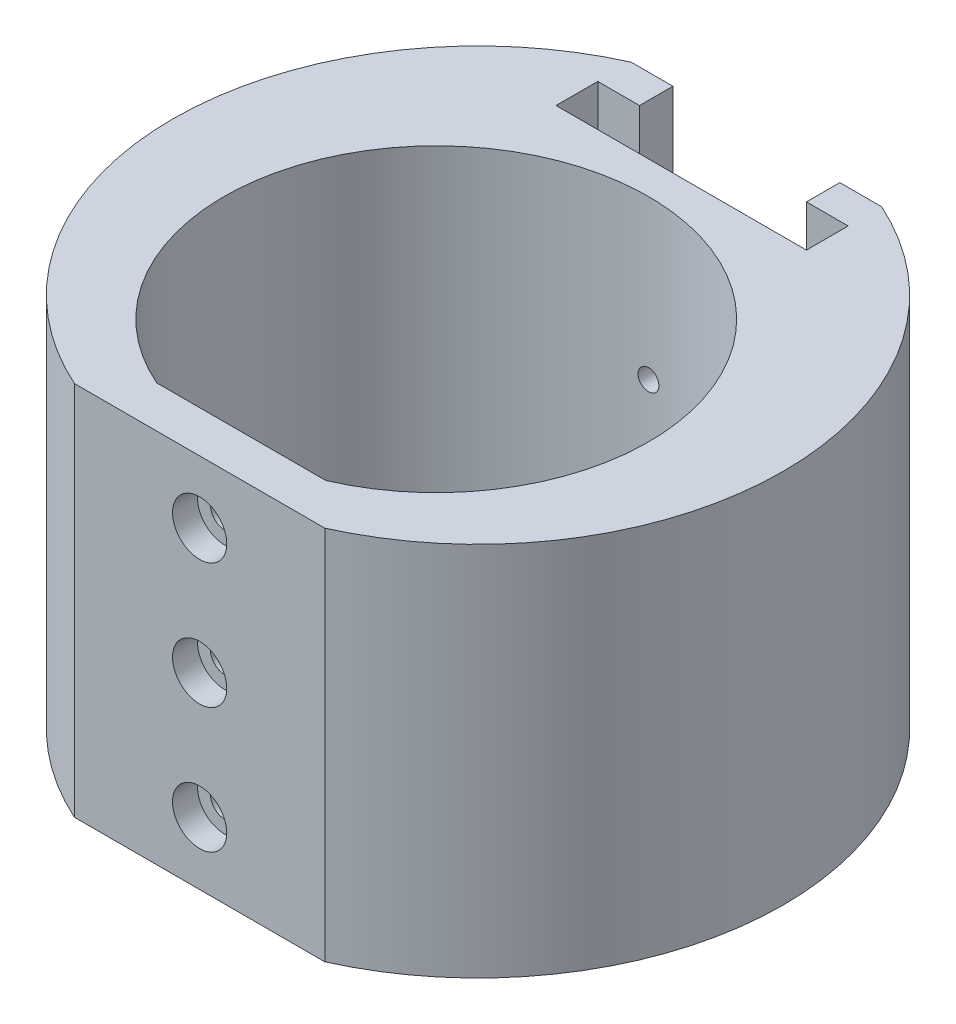
from build123d import *

# Parameters (mm, degrees)
BOSS_EXTRUDE1_DEPTH            = 22.5
CUT_EXTRUDE1_DEPTH             = 36
CBORE_FOR_M3_SHCS1_D           = 3.4
CBORE_FOR_M3_SHCS1_DEPTH       = 5
CBORE_FOR_M3_SHCS1_CBORE_D     = 6.5
CBORE_FOR_M3_SHCS1_CBORE_DEPTH = 3
CBORE_FOR_M3_SHCS1_TIP         = 1.021463052
M3X0_5_TAPPED_HOLE1_D          = 2.5
M3X0_5_TAPPED_HOLE1_DEPTH      = 27.571916674
M3X0_5_TAPPED_HOLE1_TIP        = 0.751075774
FILLET2_R                      = 4
TOLERANCING_START              = -22.5
TOLERANCING_DEPTH              = 45


# Read off the part's stored shape, not the designer's step: Tolerancing
with BuildPart() as part:
    # Sketch1 → Boss-Extrude1 (new, symmetric)
    with BuildSketch(Plane(origin=(0, 0, 0), x_dir=(1, 0, 0), z_dir=(0, 1, 0))):
        with BuildLine():
            Line((-15, -28.348661632), (15, -28.348661632))
            ThreePointArc((15, -28.348661632), (36.566832412, 5), (15, 38.348661632))
            Line((15, 38.348661632), (-15, 38.348661632))
            ThreePointArc((-15, 38.348661632), (-36.566832412, 5), (-15, -28.348661632))
        make_face()
        with BuildLine():
            Line((-10, -23.348661632), (10, -23.348661632))
            ThreePointArc((10, -23.348661632), (0, 25.4), (-10, -23.348661632))
        make_face(mode=Mode.SUBTRACT)
    extrude(amount=BOSS_EXTRUDE1_DEPTH, both=True)

    # Sketch4 → Cut-Extrude1 (cut)
    with BuildSketch(Plane(origin=(0, 22.5, 0), x_dir=(1, 0, 0), z_dir=(0, 1, 0))):
        Polygon((-10, 38.348661632), (-10, 34.348661632), (-15, 34.348661632), (-15, 29.348661632), (15, 29.348661632), (15, 34.348661632), (10, 34.348661632), (10, 38.348661632), align=None)
    extrude(amount=-CUT_EXTRUDE1_DEPTH, mode=Mode.SUBTRACT)

    # CBORE for M3 SHCS1
    with Locations(Plane.XY.offset(28.348661632)):
        with Locations((0, 0), (0, 15), (0, -15)):
            CounterBoreHole(CBORE_FOR_M3_SHCS1_D / 2, CBORE_FOR_M3_SHCS1_CBORE_D / 2, CBORE_FOR_M3_SHCS1_CBORE_DEPTH, depth=CBORE_FOR_M3_SHCS1_DEPTH)
            with Locations((0, 0, -(CBORE_FOR_M3_SHCS1_DEPTH + CBORE_FOR_M3_SHCS1_TIP / 2))):  # 118° drill point
                Cone(0, CBORE_FOR_M3_SHCS1_D / 2, CBORE_FOR_M3_SHCS1_TIP, mode=Mode.SUBTRACT)

    # M3x0.5 Tapped Hole1
    with Locations(Plane(origin=(0, 0, -29.348661632), x_dir=(-1, 0, 0), z_dir=(0, 0, -1))):
        with Locations((0, 3.5), (0, -6.5)):
            Hole(M3X0_5_TAPPED_HOLE1_D / 2, depth=M3X0_5_TAPPED_HOLE1_DEPTH)
            with Locations((0, 0, -(M3X0_5_TAPPED_HOLE1_DEPTH + M3X0_5_TAPPED_HOLE1_TIP / 2))):  # 118° drill point
                Cone(0, M3X0_5_TAPPED_HOLE1_D / 2, M3X0_5_TAPPED_HOLE1_TIP, mode=Mode.SUBTRACT)

    # Fillet2
    fillet2_edges = [part.edges().sort_by_distance(p)[0] for p in [
        (10, -13.5, -36.348661632),
        (15, -13.5, -31.848661632),
        (-15, -13.5, -31.848661632),
        (-10, -13.5, -36.348661632),
    ]]
    fillet(fillet2_edges, radius=FILLET2_R)

    # Tolerancing outline → Tolerancing (cut)
    with BuildSketch(Plane(origin=(0, 0, 0), x_dir=(1, 0, 0), z_dir=(0, 1, 0)).offset(TOLERANCING_START)):
        with BuildLine():
            ThreePointArc((10.126327074, -23.348661632), (0, 25.45), (-10.126327074, -23.348661632))
            Line((-10.126327074, -23.348661632), (-10, -23.348661632))
            ThreePointArc((-10, -23.348661632), (0, 25.4), (10, -23.348661632))
            Line((10, -23.348661632), (10.126327074, -23.348661632))
        make_face()
    extrude(amount=TOLERANCING_DEPTH, mode=Mode.SUBTRACT)


solid = part.part
